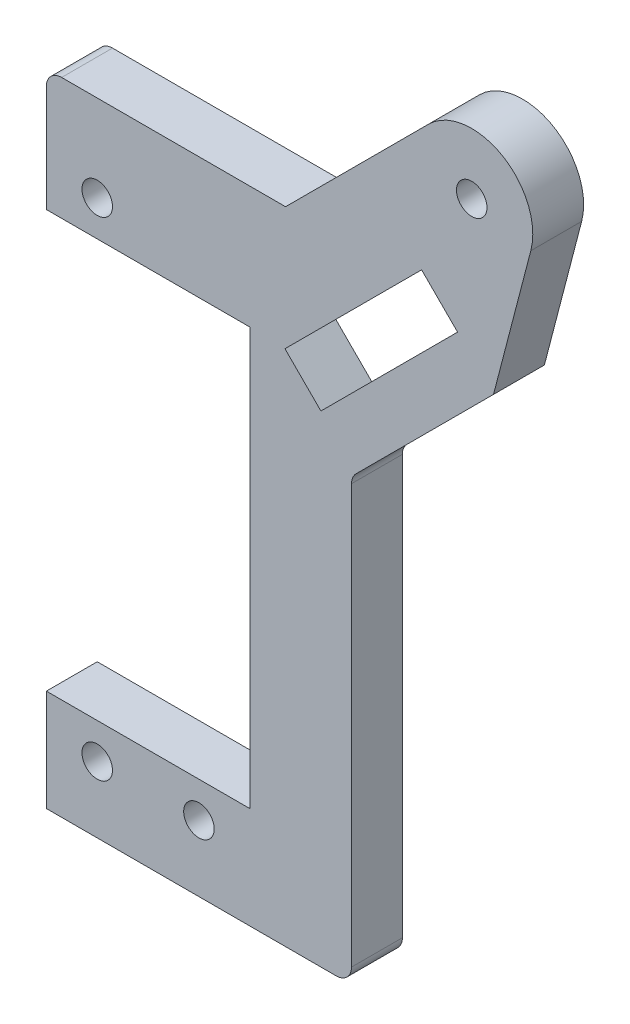
from build123d import *

# Parameters (mm, degrees)
ESQUISSE1_R        = 1.5
BOSS_EXTRU_1_DEPTH = 5
CONG_3_R           = 1.5


with BuildPart() as part:
    # Esquisse1 → Boss.-Extru.1 (new body)
    with BuildSketch(Plane.XY):
        with BuildLine():
            Line((11, 10), (0, 10))
            Line((0, 10), (0, 0))
            Line((0, 0), (30, 0))
            Line((30, 0), (30, 43.28152075))
            Line((30, 43.28152075), (43.961530357, 57.243051107))
            Line((43.961530357, 57.243051107), (47.625955008, 71.306985316))
            ThreePointArc((47.625955008, 71.306985316), (44.801829917, 78.026294211), (37.577164466, 77.06244584))
            Line((37.577164466, 77.06244584), (23.514718626, 63))
            Line((23.514718626, 63), (0, 63))
            Line((0, 63), (0, 51))
            Line((0, 51), (11, 51))
            Line((11, 51), (20, 51))
            Line((20, 51), (20, 10))
            Line((20, 10), (11, 10))
        make_face()
        with Locations((5, 6.5)):
            Circle(ESQUISSE1_R, mode=Mode.SUBTRACT)
        with Locations((15, 6.5)):
            Circle(ESQUISSE1_R, mode=Mode.SUBTRACT)
        with Locations((5, 54.5)):
            Circle(ESQUISSE1_R, mode=Mode.SUBTRACT)
        Polygon((23.455433703, 50.879090077), (36.890462545, 64.314118919), (40.425996451, 60.778585013), (26.990967608, 47.343556171), align=None, mode=Mode.SUBTRACT)
        with Locations((41.819805153, 72.819805153)):
            Circle(ESQUISSE1_R, mode=Mode.SUBTRACT)
    extrude(amount=BOSS_EXTRU_1_DEPTH)

    # Congé3
    cong_3_edges = [part.edges().sort_by_distance(p)[0] for p in [
        (0, 63, 2.5),
        (30, 0, 2.5),
        (30, 43.28152075, 2.5),
    ]]
    fillet(cong_3_edges, radius=CONG_3_R)


solid = part.part
